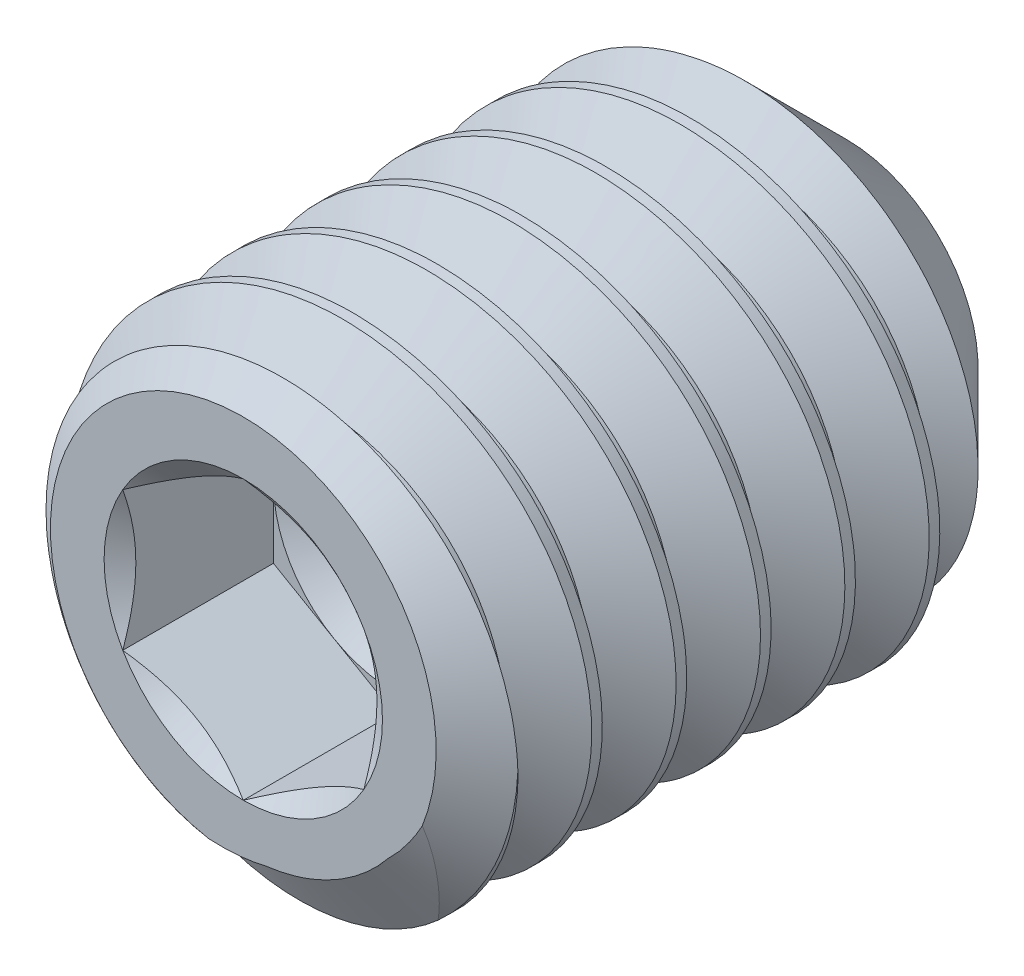
from build123d import *

# Parameters (mm, degrees)
CUT_SWEEP_PITCH   = 0.7
HEX_EXTRUDE_DEPTH = 1.25


with BuildPart() as part:
    # Body Sketch → Body Revolve (revolve)
    with BuildSketch(Plane(origin=(0, 0, 0), x_dir=(0, 0, -1), z_dir=(1, 0, 0))):
        Polygon((-2.170749467, 0), (-2.170749467, 1.6), (-1.890666452, 2), (1.925180345, 2), (2.829250533, 1.095929813), (2.170749467, 0), align=None)
    revolve(axis=Axis((0, 0, -2.170749467), (0, 0, 1)))

    # Cut Sweep: the profile of Cut Sweep Sketch profile screwed along a right-hand helix of 8.142857 turns, 6 arcs to a turn; built about Z, then put on its axis
    cut_sweep_z = Axis((0, 0, 0), (0, 0, 1))
    cut_sweep_corners = [(2.0003, 0, 0.000173205), (2.0003, 0, -0.612673205), (1.545336663, 0, -0.35), (1.545336663, 0, -0.2625)]
    with BuildLine(mode=Mode.PRIVATE) as cut_sweep_profile:
        Line(cut_sweep_corners[0], cut_sweep_corners[1])
        Line(cut_sweep_corners[1], cut_sweep_corners[2])
        Line(cut_sweep_corners[2], cut_sweep_corners[3])
        Line(cut_sweep_corners[3], cut_sweep_corners[0])
    cut_sweep_cap = Face(cut_sweep_profile.wire())
    cut_sweep_turn_angles = [0, 30, 60, 90, 120, 150, 180, 210, 240, 270, 300, 330, 360]
    cut_sweep_turn_weights = [1, 0.8660254037844387, 1, 0.8660254037844387, 1, 0.8660254037844387, 1, 0.8660254037844387, 1, 0.8660254037844387, 1, 0.8660254037844387, 1]
    cut_sweep_turn_rails = [Edge.make_bspline([Vector(p[0], p[1], 0).rotate(cut_sweep_z, cut_sweep_turn_angles[k]) / cut_sweep_turn_weights[k] + Vector(0, 0, p[2] + CUT_SWEEP_PITCH * cut_sweep_turn_angles[k] / 360) for k in range(13)], [0, 0, 0, 1, 1, 2, 2, 3, 3, 4, 4, 5, 5, 6, 6, 6], 2, cut_sweep_turn_weights) for p in cut_sweep_corners]
    cut_sweep_turn_sides = [Face.make_surface_from_curves(cut_sweep_turn_rails[p[0]], cut_sweep_turn_rails[p[1]]) for p in [(0, 1), (1, 2), (2, 3), (3, 0)]]
    cut_sweep_last_angles = [2880, 2905.714285714, 2931.428571429]
    cut_sweep_last_weights = [1, 0.900968867902367, 1]
    cut_sweep_last_rails = [Edge.make_bspline([Vector(p[0], p[1], 0).rotate(cut_sweep_z, cut_sweep_last_angles[k]) / cut_sweep_last_weights[k] + Vector(0, 0, p[2] + CUT_SWEEP_PITCH * cut_sweep_last_angles[k] / 360) for k in range(3)], [0, 0, 0, 1, 1, 1], 2, cut_sweep_last_weights) for p in cut_sweep_corners]
    cut_sweep_last_sides = [Face.make_surface_from_curves(cut_sweep_last_rails[p[0]], cut_sweep_last_rails[p[1]]) for p in [(0, 1), (1, 2), (2, 3), (3, 0)]]
    cut_sweep = Plane(origin=(0, 0, -2.829250533), x_dir=(0, 1, 0), z_dir=(0, 0, 1)) * Solid(Shell([*[p.moved(Location((0, 0, CUT_SWEEP_PITCH * i))) for i in range(8) for p in cut_sweep_turn_sides], *cut_sweep_last_sides, cut_sweep_cap, cut_sweep_cap.rotate(cut_sweep_z, 2931.428571429).moved(Location((0, 0, CUT_SWEEP_PITCH * 2931.428571429 / 360)))]))
    add(cut_sweep, mode=Mode.SUBTRACT)

    # Hex Sketch → Hex Extrude (cut)
    with BuildSketch(Plane.XY.offset(2.170749467)):
        Polygon((0, 1.154700538), (-1, 0.577350269), (-1, -0.577350269), (0, -1.154700538), (1, -0.577350269), (1, 0.577350269), align=None)
    extrude(amount=-HEX_EXTRUDE_DEPTH, mode=Mode.SUBTRACT)

    # Hex Entry Extrude cone 1 section (through the dimple's axis) → Hex Entry Extrude (revolve, cut)
    with BuildSketch(Plane(origin=(0, 0, 2.170749467), x_dir=(0, -1, 0), z_dir=(1, 0, 0))):
        Polygon((0, 0), (1.154700538, 0), (0, 0.808530021), align=None)
    revolve(axis=Axis((0, 0, 2.170749467), (0, 0, -1)), mode=Mode.SUBTRACT)

    # Hex Bottom Extrude cone 1 section (through the dimple's axis) → Hex Bottom Extrude (revolve, cut)
    with BuildSketch(Plane(origin=(0, 0, 0.920749467), x_dir=(0, -1, 0), z_dir=(1, 0, 0))):
        Polygon((0, 0), (1, 0), (0, 0.577350269), align=None)
    revolve(axis=Axis((0, 0, 0.920749467), (0, 0, -1)), mode=Mode.SUBTRACT)


solid = part.part
